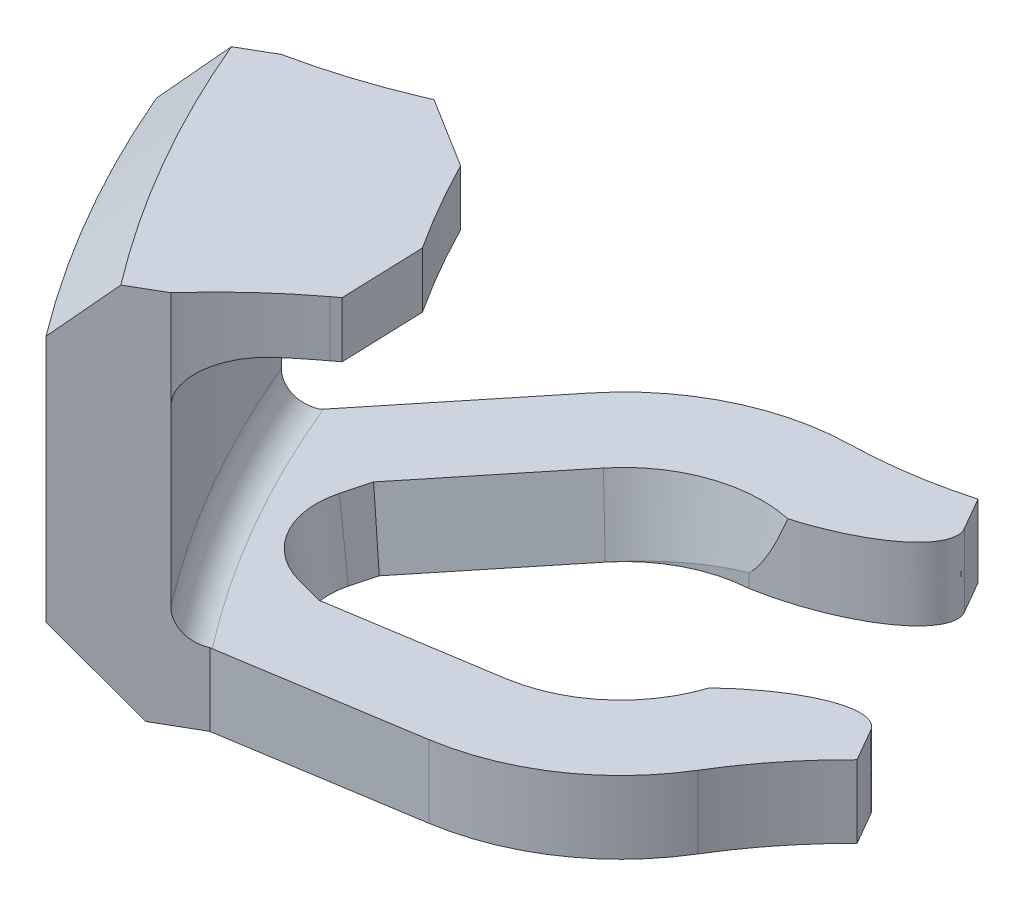
from build123d import *

# Parameters (mm, degrees)
EXTRUDE_1_DEPTH     = 2.4
EXTRUDE_1_DRAFT     = 10.000000000000021
EXTRUDE_2_DEPTH     = 12.4
EXTRUDE_4_DEPTH     = 2.4
EXTRUDE_START       = -1.84
EXTRUDE_3_DEPTH     = 1.84
CHAMFER_1_SIZE      = 2.4
FILLET_3_R          = 1
FILLET_4_R          = 19
CHAMFER_2_SIZE      = 1.5
CHAMFER_3_SIZE      = 1.5
FILLET_5_SIZE       = 2.4
FILLET_5_SIZE_2     = 1.4
FILLET_8_R          = 15
CUT_EXTRUDE_2_DEPTH = 5
FILLET_6_DEPTH      = 2.4
FILLET_7_DEPTH      = 2.4
CHAMFER_4_SIZE      = 1.8


with BuildPart() as part:
    # 草图1 → 凸台-拉伸1 (with draft: the straight prism first)
    with BuildSketch(Plane(origin=(0, 0, 0), x_dir=(1, 0, 0), z_dir=(0, 1, 0))):
        with BuildLine():
            Line((-8, -10.39230484541326), (-13.000000000000005, -1.7320508075688719))
            Line((-13.000000000000005, -1.7320508075688719), (-21.967816979362475, -6.909622354647092))
            Line((-21.967816979362475, -6.909622354647092), (-22.707399570917065, -6.711454425652112))
            ThreePointArc((-22.707399570917065, -6.711454425652112), (-27.04566788326862, -6.825066693061728), (-30.6221750608845, -9.283130179980438))
            Line((-30.6221750608845, -9.283130179980438), (-34.43427486961312, -13.990668154170681))
            Line((-34.43427486961312, -13.990668154170681), (-34.61139932518726, -14.209398025530225))
            Line((-34.61139932518726, -14.209398025530225), (-35.428587503869785, -14.681201840470763))
            ThreePointArc((-35.428587503869785, -14.681201840470763), (-33.21207423513341, -19.174999999999695), (-30.428587503869863, -23.341455878315195))
            Line((-30.428587503869863, -23.341455878315195), (-29.611399325157414, -22.86965206335739))
            Line((-29.611399325157414, -22.86965206335739), (-29.333411472153603, -22.825622720870605))
            Line((-29.333411472153603, -22.825622720870605), (-23.35051542170495, -21.878016642325832))
            ThreePointArc((-23.35051542170495, -21.878016642325832), (-19.4335158344601, -20.009702780252802), (-17.165989990997385, -16.309458328474033))
            Line((-17.165989990997385, -16.309458328474033), (-16.967816979363704, -15.569876392492032))
            Line((-16.967816979363704, -15.569876392492032), (-8, -10.39230484541326))
        make_face()
        with BuildLine():
            Line((-27.917710857810967, -11.473169762795624), (-31.26430328260419, -15.605855608999667))
            Line((-31.26430328260419, -15.605855608999667), (-31.480162480983196, -16.41144743799068))
            ThreePointArc((-31.480162480983196, -16.41144743799068), (-31.264379416774442, -18.05049776957139), (-29.95281180657393, -19.056896658743568))
            Line((-29.95281180657393, -19.056896658743568), (-29.147219046463054, -19.272753069842064))
            Line((-29.147219046463054, -19.272753069842064), (-23.894912087940103, -18.440861965883116))
            ThreePointArc((-23.894912087940103, -18.440861965883116), (-21.762087000118, -17.42355577622036), (-20.527408297941975, -15.40875473364509))
            Line((-20.527408297941975, -15.40875473364509), (-19.958845574370134, -13.286877913181291))
            ThreePointArc((-19.958845574370134, -13.286877913181291), (-20.174626779333174, -11.64782603948194), (-21.486196868626088, -10.641428268238217))
            Line((-21.486196868626088, -10.641428268238217), (-23.608077089277337, -10.072879719767714))
            ThreePointArc((-23.608077089277337, -10.072879719767714), (-25.970285289887677, -10.134742247833366), (-27.917710857810967, -11.473169762795624))
        make_face(mode=Mode.SUBTRACT)
    extrude(amount=EXTRUDE_1_DEPTH)
    # 凸台-拉伸1: the draft: its side faces are tilted about the plane it starts from
    extrude_1_sides = [part.faces().sort_by_distance(p)[0] for p in [
        (-12.48390849, 1.2, 12.981090619),
        (-29.59100707, 1.2, 13.539512686),
        (-31.372232882, 1.2, 16.008651523),
        (-31.264379417, 1.2, 18.05049777),
        (-29.550015427, 1.2, 19.164824864),
        (-26.521065567, 1.2, 18.856807518),
        (-21.762087, 1.2, 17.423555776),
        (-20.243126936, 1.2, 14.347816323),
        (-20.174626779, 1.2, 11.647826039),
        (-22.547136979, 1.2, 10.357153994),
        (-25.97028529, 1.2, 10.134742248),
        (-19.433515834, 1.2, 20.00970278),
        (-26.480957373, 1.2, 22.373834353),
        (-30.019993415, 1.2, 23.105553971),
        (-33.212074235, 1.2, 19.175),
        (-35.019993415, 1.2, 14.445299933),
        (-32.616787193, 1.2, 11.746264103),
        (-27.045667883, 1.2, 6.825066693),
        (-22.337608275, 1.2, 6.81053839),
        (-17.48390849, 1.2, 4.320836581),
        (-10.5, 1.2, 6.062177826),
        (-17.066903485, 1.2, 15.93966736),
    ]]
    draft(extrude_1_sides, Plane(origin=(0, 0, 0), x_dir=(1, 0, 0), z_dir=(0, 1, 0)), EXTRUDE_1_DRAFT)



with BuildPart() as body_2:
    # 草图3 → 凸台-拉伸2 (new body)
    with BuildSketch(Plane.XZ):
        with BuildLine():
            Line((-30.428587503869863, 23.341455878315195), (-33.04738914463361, 24.853421710564383))
            ThreePointArc((-33.04738914463361, 24.853421710564383), (-35.81015044648663, 20.67499999999986), (-38.04738914463341, 16.193167672720275))
            Line((-38.04738914463341, 16.193167672720275), (-35.42858750386978, 14.681201840470765))
            ThreePointArc((-35.42858750386978, 14.681201840470765), (-33.21207423513341, 19.17499999999969), (-30.428587503869863, 23.341455878315195))
        make_face()
    extrude(amount=-EXTRUDE_2_DEPTH)


with BuildPart() as part_1:
    add(part.part)

    add(body_2.part)  # 凸台-拉伸4 merges body 2
    # 草图2 → 凸台-拉伸4 (add)
    with BuildSketch(Plane.XZ):
        with BuildLine():
            Line((-13.000000000000005, 1.7320508075688719), (-8, 10.39230484541326))
            Line((-8, 10.39230484541326), (-16.967816979363704, 15.569876392492032))
            Line((-16.967816979363704, 15.569876392492032), (-17.165989990997385, 16.309458328474033))
            ThreePointArc((-17.165989990997385, 16.309458328474033), (-19.433515834460025, 20.009702780252884), (-23.35051542170494, 21.878016642325914))
            Line((-23.35051542170494, 21.878016642325914), (-29.611399325157414, 22.86965206335739))
            Line((-29.611399325157414, 22.86965206335739), (-30.428587503869863, 23.341455878315195))
            ThreePointArc((-30.428587503869863, 23.341455878315195), (-33.21207423513341, 19.17499999999969), (-35.428587503869785, 14.681201840470749))
            Line((-35.428587503869785, 14.681201840470749), (-34.61139932518726, 14.209398025530225))
            Line((-34.61139932518726, 14.209398025530225), (-30.6221750608845, 9.283130179980438))
            ThreePointArc((-30.6221750608845, 9.283130179980438), (-27.04566788326878, 6.825066693061228), (-22.707399570916962, 6.7114544256517314))
            Line((-22.707399570916962, 6.7114544256517314), (-21.967816979362475, 6.909622354647092))
            Line((-21.967816979362475, 6.909622354647092), (-13.000000000000005, 1.7320508075688719))
        make_face()
        Polygon((-28.267922287633624, 9.69566060346451), (-32.99491205073382, 15.569876392492032), (-31.81295668178173, 19.594100965997992), (-26.34681601079053, 20.919608689289614), (-19.04027200355443, 17.12116385307054), (-18.489608424453053, 9.956624945753184), (-26.729419610491885, 8.295337377312261), align=None, mode=Mode.SUBTRACT)
    extrude(amount=-EXTRUDE_4_DEPTH)

    # 草图4 → 凸台-拉伸3 (add)
    with BuildSketch(Plane(origin=(0, 12.4, 0), x_dir=(1, 0, 0), z_dir=(0, 1, 0)).offset(EXTRUDE_START)):
        with BuildLine():
            Line((-30.226281339811546, -12.864463314361807), (-38.04738914463341, -16.19316767272028))
            ThreePointArc((-38.04738914463341, -16.19316767272028), (-35.81015044648664, -20.674999999999862), (-33.04738914463361, -24.853421710564383))
            Line((-33.04738914463361, -24.853421710564383), (-26.254092706196243, -19.74449584503119))
            ThreePointArc((-26.254092706196243, -19.74449584503119), (-28.4489345143189, -16.424999999999862), (-30.226281339811546, -12.864463314361807))
        make_face()
    extrude(amount=EXTRUDE_3_DEPTH)

    # 倒角1
    chamfer_1_edges = [part_1.edges().sort_by_distance(p)[0] for p in [
        (-35.81015044648664, 0, 20.674999999999848),
    ]]
    chamfer(chamfer_1_edges, length=CHAMFER_1_SIZE)

    # 圆角3
    fillet_3_edges = [part_1.edges().sort_by_distance(p)[0] for p in [
        (-33.21207423513341, 2.4, 19.174999999999685),
    ]]
    fillet(fillet_3_edges, radius=FILLET_3_R)

    # 圆角4
    # the kernel refuses this fillet: 19 mm, written as the material it adds along each edge
    with BuildSketch(Plane(origin=(-30.64975510753807, 12.4, 23.050271405082075), x_dir=(0.6048533830099544, 0, 0.7963368540143131), z_dir=(0, -1, 0))) as fillet_4_piece_1:
        with BuildLine():
            CenterArc((19.01747725145387, -3.620707526685834), FILLET_4_R, 169.01432561321406, 11.258823825178695)
            Line((0.01769316413072922, -3.711286967523243), (0, 0))
            ThreePointArc((0, 0), (0.1828274503215999, 0.00043580269250474), (0.36565490064319695, 1e-17))
        make_face()
    extrude(amount=1.8399999999999999)
    with BuildSketch(Plane(origin=(-35.28699815469627, 12.4, 15.018330840358463), x_dir=(-0.38722125404118524, 0, -0.9219868222587414), z_dir=(0, -1, 0))) as fillet_4_piece_2:
        with BuildLine():
            CenterArc((19.01747725145391, 3.620707526687544), FILLET_4_R, 179.7268505616068, 11.258823825184436)
            Line((0.01769316413076899, 3.7112869675251012), (0, 0))
            ThreePointArc((0, 0), (0.1828274503217857, -0.00043580269250211), (0.36565490064356865, -1e-17))
        make_face()
    extrude(amount=1.8399999999999999)

    # 倒角2
    # the kernel refuses this chamfer: 2.14222201, 1.5 mm, written as the material it takes off along each edge
    with BuildSketch(Plane(origin=(-30.226281339811543, 4.744273175478047, 12.864463314361808), x_dir=(-0.9201303299790425, 0, 0.3916122774539359), z_dir=(0, 1, 0))) as chamfer_2_piece_1:
        with BuildLine():
            Line((CHAMFER_2_SIZE, 1e-17), (-0.07732795533825856, 2.2526577753949484))
            ThreePointArc((-0.07732795533825856, 2.2526577753949484), (-0.02059122506408261, 1.1629357197030856), (0, 0))
            Line((0, 0), (CHAMFER_2_SIZE, 1e-17))
        make_face()
    extrude(amount=13.471453649043909, mode=Mode.SUBTRACT)

    # 倒角3
    # the kernel refuses this chamfer: 2.14222201, 1.5 mm, written as the material it takes off along each edge
    with BuildSketch(Plane(origin=(-26.254092706196246, 4.744273175477979, 19.74449584503119), x_dir=(-0.5732775613281392, 0, -0.8193612375977165), z_dir=(0, 1, 0))) as chamfer_3_piece_1:
        with BuildLine():
            Line((2.253984619673398, -1.7e-16), (-CHAMFER_3_SIZE * 0.0343072240437, CHAMFER_3_SIZE * 0.999411333925))
            Line((-CHAMFER_3_SIZE * 0.0343072240437, CHAMFER_3_SIZE * 0.999411333925), (0, 0))
            ThreePointArc((0, 0), (1.1629575666695002, 0.0193179925758491), (2.253984619673398, -1.7e-16))
        make_face()
    extrude(amount=13.471453649044044, mode=Mode.SUBTRACT)

    # 圆角5
    # a fillet whose section is not a circle: 2.4, 1.4 mm, written as the material it adds along each edge
    with BuildSketch(Plane(origin=(-2.0606e-13, 10.56, 1.3323e-13), x_dir=(-0.7992113456985149, 0, 0.601050101827434), z_dir=(0.601050101827434, 0, 0.7992113456985149))) as fillet_5_piece_1:
        with BuildLine():
            Bezier((38.34999999999976 - FILLET_5_SIZE, 0), (38.34999999999976, 0), (38.34999999999976, FILLET_5_SIZE_2), weights=[1, 0.7071067811865476, 1])
            Line((38.34999999999976, FILLET_5_SIZE_2), (38.34999999999976, 0))
            Line((38.34999999999976, 0), (38.34999999999976 - FILLET_5_SIZE, 0))
        make_face()
    revolve(axis=Axis((-2.0606e-13, 10.56, 1.3323e-13), (0, -1, 0)), revolution_arc=13.890285454944133)
    with BuildSketch(Plane(origin=(-3.461387621e-08, 10.56, 2.627939821e-08), x_dir=(-0.7992113457016207, 0, 0.6010501018233042), z_dir=(-0.6010501018233042, 0, -0.7992113457016207))) as fillet_5_piece_2_section:
        with BuildLine():
            Bezier((38.34999995654087 - FILLET_5_SIZE, 0), (38.34999995654051, 0), (38.34999995654051, -FILLET_5_SIZE_2), weights=[1, 0.7071067811865476, 1])
            Line((38.34999995654051, -FILLET_5_SIZE_2), (38.34999995654087, 0))
            Line((38.34999995654087, 0), (38.34999995654087 - FILLET_5_SIZE, 0))
        make_face()
    fillet_5_piece_2 = revolve(axis=Axis((-3.461387621e-08, 10.56, 2.627939821e-08), (0, 1, 0)), revolution_arc=9.510436623291234, mode=Mode.PRIVATE)
    fillet_5_piece_2 = fillet_5_piece_2 - Plane(origin=(-16.263666814571195, 10.56, 36.004592214384765), x_dir=(0.6048533830101342, 0, 0.7963368540141766), z_dir=(0, 1, 0)) * Cylinder(19, 154, mode=Mode.PRIVATE)
    fillet_5_piece_2 = split(fillet_5_piece_2, bisect_by=Plane(origin=(2.499999962665584, 10.56, 4.330127040493212), z_dir=(-0.4999999999996767, 0, -0.8660254037846254)), keep=Keep.TOP, mode=Mode.PRIVATE)
    add(fillet_5_piece_2)
    with BuildSketch(Plane(origin=(-4.006483323e-08, 10.56, 1.683765483e-08), x_dir=(-0.9201303299770334, 0, 0.39161227745865645), z_dir=(0.39161227745865645, 0, 0.9201303299770334))) as fillet_5_piece_3_section:
        with BuildLine():
            Bezier((38.34999995654088 - FILLET_5_SIZE, 0), (38.34999995654086, 0), (38.34999995654086, FILLET_5_SIZE_2), weights=[1, 0.7071067811865476, 1])
            Line((38.34999995654086, FILLET_5_SIZE_2), (38.34999995654088, 0))
            Line((38.34999995654088, 0), (38.34999995654088 - FILLET_5_SIZE, 0))
        make_face()
    fillet_5_piece_3 = revolve(axis=Axis((-4.006483323e-08, 10.56, 1.683765483e-08), (0, -1, 0)), revolution_arc=9.510436623292696, mode=Mode.PRIVATE)
    fillet_5_piece_3 = fillet_5_piece_3 - Plane(origin=(-39.312724917839226, 10.56, -3.9175474870895535), x_dir=(-0.38722125404093544, 0, -0.9219868222588462), z_dir=(0, 1, 0)) * Cylinder(19, 154, mode=Mode.PRIVATE)
    fillet_5_piece_3 = split(fillet_5_piece_3, bisect_by=Plane(origin=(-2.5000000373308557, 10.56, -4.330126997352951), z_dir=(0.4999999999996709, 0, 0.8660254037846287)), keep=Keep.TOP, mode=Mode.PRIVATE)
    add(fillet_5_piece_3)

    # 圆角8
    fillet_8_edges = [part_1.edges().sort_by_distance(p)[0] for p in [
        (-16.967816979363704, 1.2, 15.569876392492032),
        (-21.967816979362475, 1.2, 6.909622354647092),
    ]]
    fillet(fillet_8_edges, radius=FILLET_8_R)

    # 草图5 → 切除-拉伸2 (cut)
    with BuildSketch(Plane.XZ):
        with BuildLine():
            Line((-29.147219046463054, 19.272753069842064), (-31.26430328260419, 15.605855608999667))
            Line((-31.26430328260419, 15.605855608999667), (-27.917710857810967, 11.473169762795624))
            ThreePointArc((-27.917710857810967, 11.473169762795624), (-26.519580592002317, 10.334215480262145), (-24.78185492305829, 9.852245981886409))
            ThreePointArc((-24.78185492305829, 9.852245981886409), (-22.06180246526334, 9.58692328939854), (-19.411053683835984, 8.921632073413566))
            Line((-19.411053683835984, 8.921632073413566), (-21.15527408053382, 5.900553726782096))
            Line((-21.15527408053382, 5.900553726782096), (-15.208253993285949, -4.420406034748125))
            Line((-15.208253993285949, -4.420406034748125), (0.1921696049414131, 10.177783304028027))
            Line((0.1921696049414131, 10.177783304028027), (-15.687666464212418, 15.370727913953607))
            Line((-15.687666464212418, 15.370727913953607), (-17.43188686086262, 12.34964956740465))
            ThreePointArc((-17.43188686086262, 12.34964956740465), (-19.33342034539163, 14.31261974261085), (-20.923222766188925, 16.535592923816857))
            ThreePointArc((-20.923222766188925, 16.535592923816857), (-22.209483528439453, 17.799522767055162), (-23.894912087940103, 18.440861965883116))
            Line((-23.894912087940103, 18.440861965883116), (-29.147219046463054, 19.272753069842064))
        make_face()
    extrude(amount=-CUT_EXTRUDE_2_DEPTH, mode=Mode.SUBTRACT)

    # 圆角6: read off the stored shape, not the designer's step
    # 圆角6 outline → 圆角6 (cut)
    with BuildSketch(Plane(origin=(0, 0, 0), x_dir=(1, 0, 0), z_dir=(0, 1, 0))):
        with BuildLine():
            Line((-19.411053684, -8.921632073), (-20.538770468, -6.968369307))
            add(Edge.make_bspline(
                [(-20.538770468, -6.968369307), (-19.4215814226651, -8.903397494873008), (-24.781854923, -9.852245982)],
                knots=[0, 0, 0, 1, 1, 1], degree=2, weights=[1, 0.573849647048003, 1]))
            ThreePointArc((-24.781854923, -9.852245982), (-22.061802466, -9.586923289), (-19.411053684, -8.921632073))
        make_face()
    extrude(amount=FILLET_6_DEPTH, mode=Mode.SUBTRACT)

    # 圆角7: read off the stored shape, not the designer's step
    # 圆角7 outline → 圆角7 (cut)
    with BuildSketch(Plane(origin=(0, 0, 0), x_dir=(1, 0, 0), z_dir=(0, 1, 0))):
        with BuildLine():
            ThreePointArc((-17.431886861, -12.349649567), (-19.333420346, -14.312619744), (-20.923222767, -16.535592926))
            add(Edge.make_bspline(
                [(-20.923222767, -16.535592926), (-17.4213591171029, -12.3678841544852), (-16.304170077, -14.302912333)],
                knots=[0, 0, 0, 1, 1, 1], degree=2, weights=[1, 0.573849647800654, 1]))
            Line((-16.304170077, -14.302912333), (-17.431886861, -12.349649567))
        make_face()
    extrude(amount=FILLET_7_DEPTH, mode=Mode.SUBTRACT)

    # 倒角4
    chamfer_4_edges = [part_1.edges().sort_by_distance(p)[0] for p in [
        (-35.81015044648664, 12.4, 20.674999999999848),
    ]]
    chamfer(chamfer_4_edges, length=CHAMFER_4_SIZE)


solid = part_1.part
